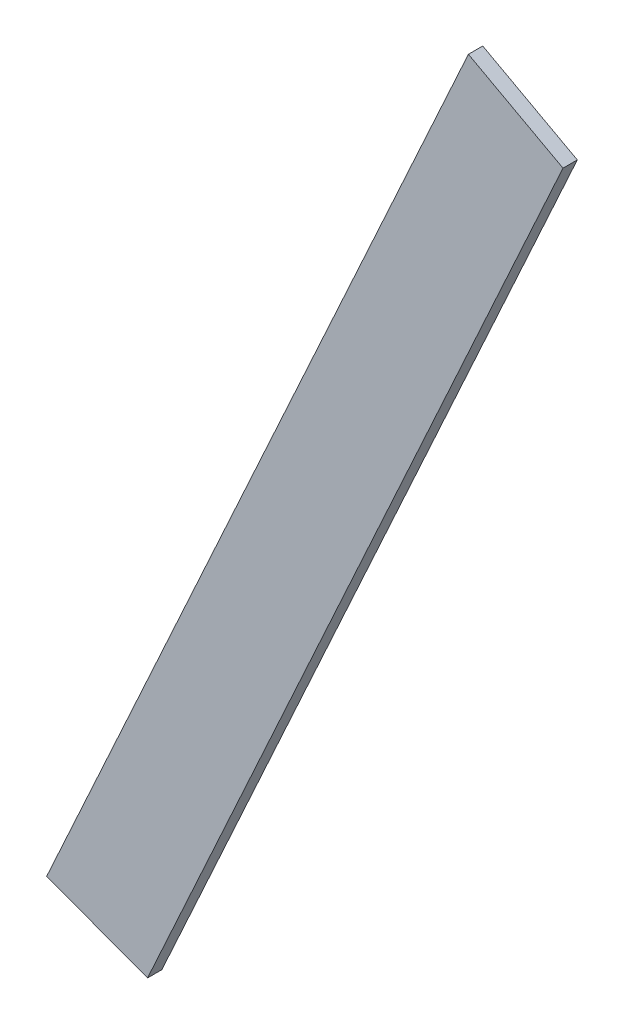
from build123d import *

# Parameters (mm, degrees)
BOSS_EXTRUDE1_DEPTH = 2


with BuildPart() as part:
    # Sketch1 → Boss-Extrude1 (new body)
    with BuildSketch(Plane.XY):
        Polygon((31.553281057, -12.433055611), (17.467498527, -7.167405104), (76.390488971, 121.756915208), (89.604257178, 114.583285268), align=None)
    extrude(amount=BOSS_EXTRUDE1_DEPTH)


solid = part.part
